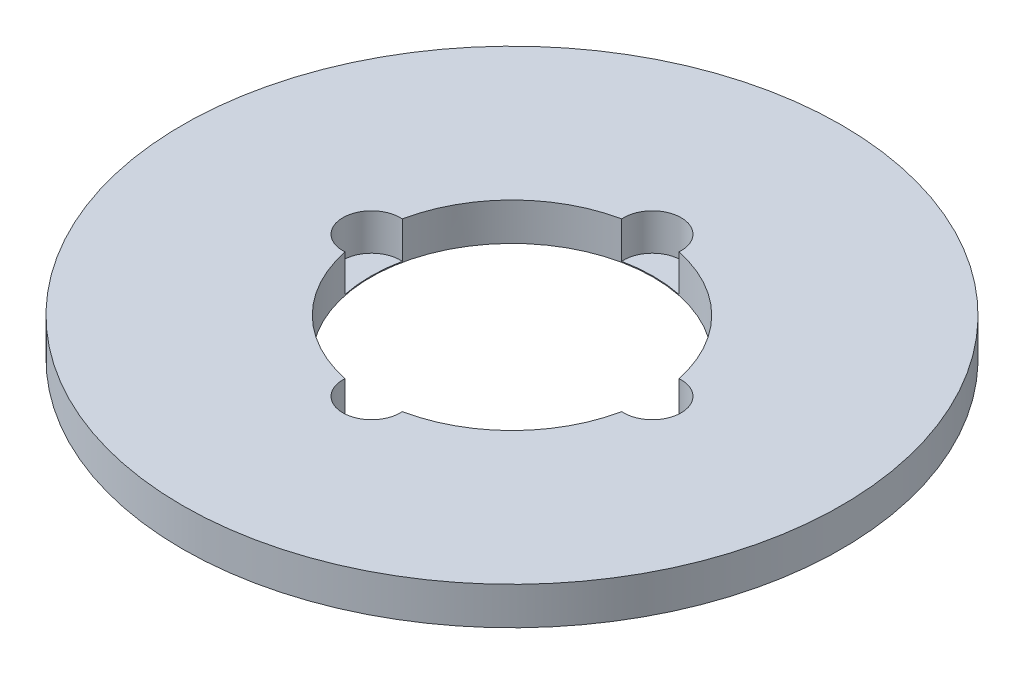
from build123d import *

# Parameters (mm, degrees)
SKETCH1_R           = 35
BOSS_EXTRUDE1_DEPTH = 4
SKETCH2_R           = 15
CUT_EXTRUDE1_DEPTH  = 50.658836072
SKETCH3_R           = 3.046232796
CUT_EXTRUDE2_DEPTH  = 3.904023411
CIRPATTERN1_COUNT   = 4


with BuildPart() as part:
    # Sketch1 → Boss-Extrude1 (new body)
    with BuildSketch(Plane(origin=(0, 0, 0), x_dir=(1, 0, 0), z_dir=(0, 1, 0))):
        Circle(SKETCH1_R)
    extrude(amount=BOSS_EXTRUDE1_DEPTH)

    # Sketch2 → Cut-Extrude1 (cut, through all)
    with BuildSketch(Plane(origin=(0, 0, 0), x_dir=(1, 0, 0), z_dir=(0, 1, 0))):
        Circle(SKETCH2_R)
    extrude(amount=CUT_EXTRUDE1_DEPTH, mode=Mode.SUBTRACT)

    # Sketch3 → Cut-Extrude2 (cut)
    with BuildSketch(Plane(origin=(0, 4, 0), x_dir=(1, 0, 0), z_dir=(0, 1, 0))):
        with Locations((-14.912651385, 0)):
            Circle(SKETCH3_R)
    cut_extrude2 = extrude(amount=-CUT_EXTRUDE2_DEPTH, mode=Mode.SUBTRACT)

    # CirPattern1: Cut-Extrude2 ×4 about axis
    cirpattern1_axis = Axis((0, 0, 0), (0, 1, 0))
    for i in range(1, CIRPATTERN1_COUNT):
        add(cut_extrude2.rotate(cirpattern1_axis, i * 360 / CIRPATTERN1_COUNT), mode=Mode.SUBTRACT)


solid = part.part
